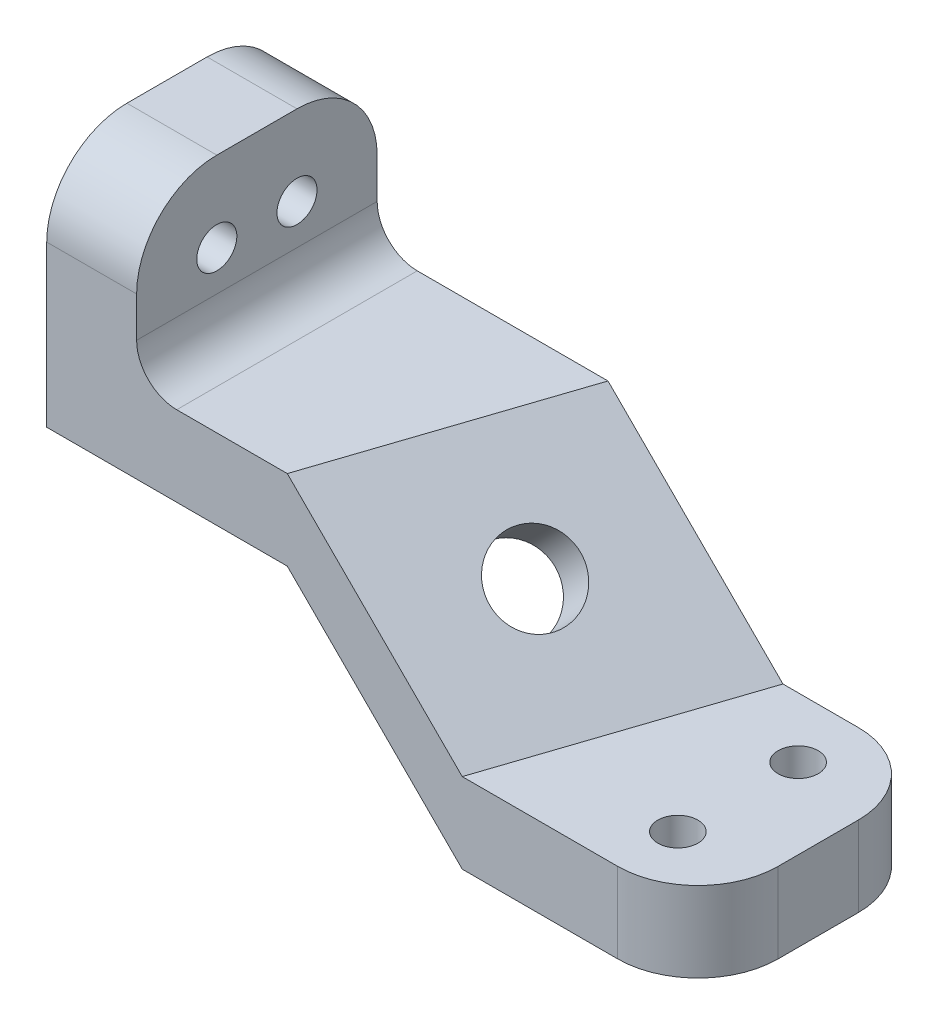
from build123d import *

# Parameters (mm, degrees)
SKETCH3_W               = 1.121172813
SKETCH3_H               = 3
BOSS_EXTRUDE1_DEPTH     = 3
SKETCH4_W               = 4
SKETCH4_H               = 1
BOSS_EXTRUDE2_DEPTH     = 3
FILLET3_R               = 1
CUT_EXTRUDE4_DEPTH      = 6.127147937
CUT_EXTRUDE4_DEPTH_BACK = 6.127147937
CUT_EXTRUDE5_DEPTH      = 6.830951895
BOSS_EXTRUDE4_REACH     = 11.163
SKETCH26_W              = 3
SKETCH26_H              = 1
FILLET6_R               = 1
SKETCH27_R              = 0.25
CUT_EXTRUDE6_DEPTH      = 10.614711327
CUT_EXTRUDE7_DEPTH      = 8.660792968
CUT_EXTRUDE7_DEPTH_BACK = 8.660792968
SKETCH28_R              = 0.5
FILLET7_R               = 0.5


with BuildPart() as part:
    # Sketch3 → Boss-Extrude1 (new body)
    with BuildSketch(Plane(origin=(0, 0, 0), x_dir=(1, 0, 0), z_dir=(0, 1, 0))):
        with Locations((0.560586407, -1.5)):
            Rectangle(SKETCH3_W, SKETCH3_H)
    extrude(amount=BOSS_EXTRUDE1_DEPTH)

    # Sketch4 → Boss-Extrude2 (add)
    with BuildSketch(Plane.XY):
        with Locations((2, 0.5)):
            Rectangle(SKETCH4_W, SKETCH4_H)
    extrude(amount=BOSS_EXTRUDE2_DEPTH)

    # Fillet3
    fillet3_edges = [part.edges().sort_by_distance(p)[0] for p in [
        (0.560586407, 3, 0),
        (0.560586407, 3, 3),
    ]]
    fillet(fillet3_edges, radius=FILLET3_R)

    # Sketch5 → Cut-Extrude4 (cut, two sides: drawn at the far end of the back side and taken through both)
    with BuildSketch(Plane(origin=(1.121172813, 0, 0), x_dir=(0, 0, -1), z_dir=(1, 0, 0)).offset(-CUT_EXTRUDE4_DEPTH_BACK)):
        with BuildLine():
            ThreePointArc((-1.75, 2), (-2, 2.25), (-2.25, 2))
            Line((-2.25, 2), (-1.75, 2))
        make_face()
        with BuildLine():
            Line((-1.75, 2), (-2.25, 2))
            ThreePointArc((-2.25, 2), (-2, 1.75), (-1.75, 2))
        make_face()
        with BuildLine():
            ThreePointArc((-0.75, 2), (-1, 2.25), (-1.25, 2))
            Line((-1.25, 2), (-0.75, 2))
        make_face()
        with BuildLine():
            Line((-0.75, 2), (-1.25, 2))
            ThreePointArc((-1.25, 2), (-1, 1.75), (-0.75, 2))
        make_face()
    extrude(amount=CUT_EXTRUDE4_DEPTH + CUT_EXTRUDE4_DEPTH_BACK, mode=Mode.SUBTRACT)

    # Sketch12 → Cut-Extrude5 (cut, through all)
    with BuildSketch(Plane.XZ):
        Polygon((4, 0), (3.000287903, 3), (4, 3), align=None)
    extrude(amount=-CUT_EXTRUDE5_DEPTH, mode=Mode.SUBTRACT)

    # Sweep1: read off the stored shape, not the designer's step
    # Sweep1: loft between two sections, ruled curve by curve
    sweep1_from = [
        Edge.make_line((5.182299836, -1.182011934, 3), (5.182299836, -2.182011934, 3)),
        Edge.make_line((3.000287903, 1, 3), (5.182299836, -1.182011934, 3)),
        Edge.make_line((5.182299836, -2.182011934, 3), (3.000287903, 0, 3)),
        Edge.make_line((3.000287903, 0, 3), (3.000287903, 1, 3)),
    ]
    sweep1_to = [
        Edge.make_line((6.182011934, -1.182011934, 0), (6.182011934, -2.182011934, 0)),
        Edge.make_line((4, 1, 0), (6.182011934, -1.182011934, 0)),
        Edge.make_line((6.182011934, -2.182011934, 0), (4, 0, 0)),
        Edge.make_line((4, 0, 0), (4, 1, 0)),
    ]
    sweep1 = Solid(Shell([*[Face.make_surface_from_curves(sweep1_from[k], sweep1_to[k]) for k in range(4)], Face(Wire(sweep1_from)), Face(Wire(sweep1_to))]))
    add(sweep1)

    # Sketch26 → Boss-Extrude4 (add, up to next)
    with BuildSketch(Plane(origin=(8.121172813, 0, 0), x_dir=(0, 0, -1), z_dir=(1, 0, 0)), mode=Mode.PRIVATE) as boss_extrude4_sk1:
        with Locations((-1.5, -1.682011934)):
            Rectangle(SKETCH26_W, SKETCH26_H)
    boss_extrude4_tool1 = extrude(boss_extrude4_sk1.sketch, amount=-BOSS_EXTRUDE4_REACH, mode=Mode.PRIVATE) - part.part
    add(boss_extrude4_tool1.solids().sort_by_distance((8.121173, -1.682012, 1.5))[0])

    # Fillet6
    fillet6_edges = [part.edges().sort_by_distance(p)[0] for p in [
        (8.121172813, -1.682011934, 0),
        (8.121172813, -1.682011934, 3),
    ]]
    fillet(fillet6_edges, radius=FILLET6_R)

    # Sketch27 → Cut-Extrude6 (cut, through all)
    with BuildSketch(Plane(origin=(0, -1.182011934, 0), x_dir=(1, 0, 0), z_dir=(0, 1, 0))):
        with Locations(Location((7.121172813, -2.25, 0), (0, 0, 270))):
            Circle(SKETCH27_R)
        with Locations(Location((7.121172813, -0.75, 0), (0, 0, 90))):
            Circle(SKETCH27_R)
    extrude(amount=-CUT_EXTRUDE6_DEPTH, mode=Mode.SUBTRACT)

    # Sketch28 → Cut-Extrude7 (cut, two sides: drawn at the far end of the back side and taken through both)
    with BuildSketch(Plane(origin=(2.368492821, 2.368492821, 0.789270309), x_dir=(0.16217717426622844, 0.16217717426622855, -0.973343273616273), z_dir=(0.6882576291963799, 0.6882576291963798, 0.2293531593546452)).offset(-CUT_EXTRUDE7_DEPTH_BACK)):
        with Locations(Location((-0.730194281, -3.310784177, 0), (0, 0, 90))):
            Circle(SKETCH28_R)
    extrude(amount=CUT_EXTRUDE7_DEPTH + CUT_EXTRUDE7_DEPTH_BACK, mode=Mode.SUBTRACT)

    # Fillet7
    fillet7_edges = [part.edges().sort_by_distance(p)[0] for p in [
        (1.121172813, 1, 1.5),
    ]]
    fillet(fillet7_edges, radius=FILLET7_R)


solid = part.part
